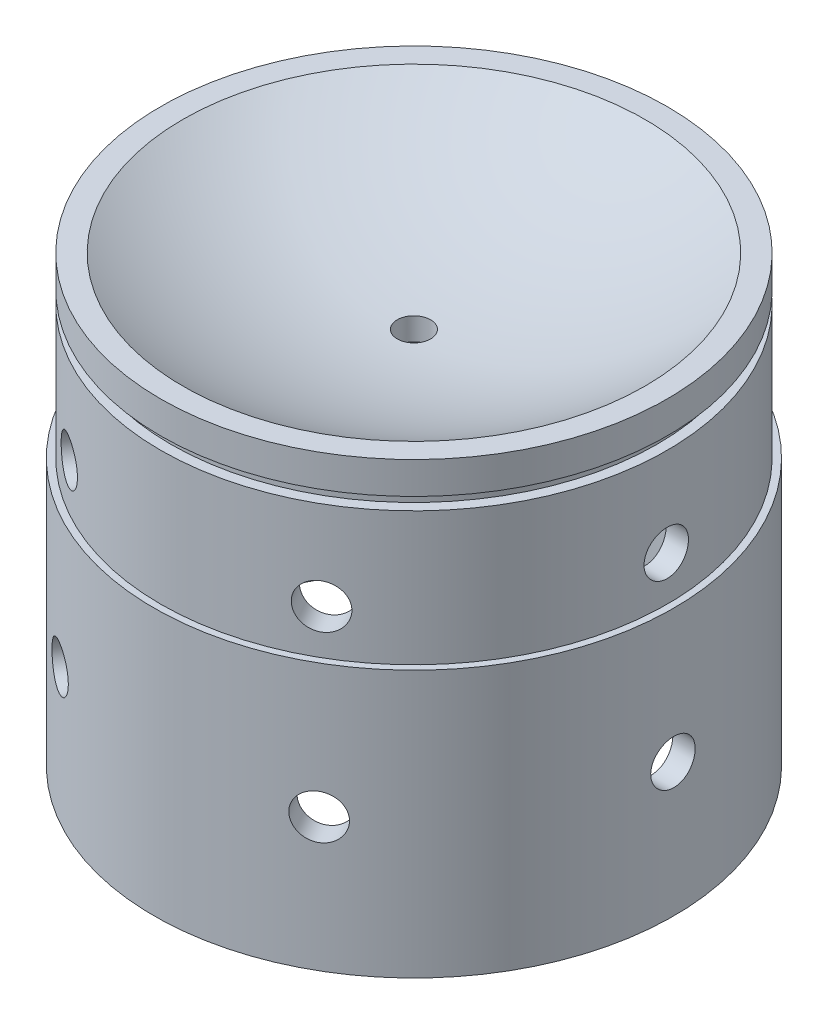
from build123d import *

# Parameters (mm, degrees)
MAIN_LINE_HOLE_REACH      = 148.158
MAIN_LINE_HOLE_END_RADIUS = 123.994333333
SKETCH10_R                = 4.7625
CHAMFER1_SIZE             = 2.54
SCALE1_SCALE              = 0.5
CIRPATTERN1_COUNT         = 6


with BuildPart() as part:
    # Sketch1 → Revolve1 (revolve)
    with BuildSketch(Plane.XY, mode=Mode.PRIVATE) as revolve1_sk:
        with BuildLine():
            Line((0, 6.35), (0, 0))
            Line((0, 0), (66.04, 0))
            Line((66.04, 0), (72.39, 0))
            Line((72.39, 0), (72.39, 12.7))
            Line((72.39, 12.7), (69.469, 12.7))
            Line((69.469, 12.7), (69.469, 16.256))
            Line((69.469, 16.256), (72.39, 16.256))
            Line((72.39, 16.256), (72.39, 25.4))
            Line((72.39, 25.4), (66.04, 25.4))
            ThreePointArc((66.04, 25.4), (34.366350184, 11.207652694), (0, 6.35))
        make_face()
        Polygon((72.39, 0), (66.04, 0), (66.04, -25.4), (67.945, -25.4), (72.39, -25.4), align=None)
        Polygon((74.295, -25.4), (72.39, -25.4), (67.945, -25.4), (67.945, -101.6), (74.295, -101.6), align=None)
    revolve(revolve1_sk.sketch.rotate(Axis((0, 0, 0), (0, 1, 0)), 90), axis=Axis((0, 0, 0), (0, 1, 0)))

    # Main Line Hole: up to this sphere (the profile starts outside it)
    main_line_hole_end = Location((0, 130.344333333, 0)) * Sphere(MAIN_LINE_HOLE_END_RADIUS, mode=Mode.PRIVATE)
    # Sketch10 → Main Line Hole (cut, up to the surface)
    with BuildSketch(Plane.XZ, mode=Mode.PRIVATE) as main_line_hole_sk1:
        with Locations(Location((0, 0, 0), (0, 0, 270))):
            Circle(SKETCH10_R)
    main_line_hole_tool1 = extrude(main_line_hole_sk1.sketch, amount=-MAIN_LINE_HOLE_REACH, mode=Mode.PRIVATE) - main_line_hole_end
    add(main_line_hole_tool1.solids().sort_by_distance((0, 0, 0))[0], mode=Mode.SUBTRACT)

    # Chamfer1
    # the kernel refuses this chamfer: 2.54 mm, written as the material it adds along each edge
    with BuildSketch(Plane(origin=(0, -25.4, 0), x_dir=(0, 0, -1), z_dir=(1, 0, 0))) as chamfer1_piece_1_section:
        Polygon((67.945 - CHAMFER1_SIZE, 0), (67.945, -CHAMFER1_SIZE), (67.945, 0), align=None)
    chamfer1_piece_1 = revolve(axis=Axis((0, -25.4, 0), (0, 1, 0)), mode=Mode.PRIVATE)
    chamfer1_piece_1 = chamfer1_piece_1 - Plane(origin=(0, -26.944579126, 0), x_dir=(0, 0, -1), z_dir=(0, -1, 0)) * Cylinder(66.04, 272, mode=Mode.PRIVATE)
    add(chamfer1_piece_1)


with BuildPart() as part_1:
    # Scale1: scaled about (0, -21.10158913, 0)
    add(part.part.scale(SCALE1_SCALE).moved(Location((0, -10.550794565, 0))))

    # Sketch9 → 1/4 (0.25) Diameter Hole1 (revolve, cut)
    with BuildSketch(Plane(origin=(37.1475, -42.300794565, 0), x_dir=(0, 0, -1), z_dir=(0, 1, 0))):
        Polygon((0, 0), (0, 39.054232465), (3.175, 37.1465), (3.175, 0), align=None)
    f_1_4_0_25_diameter_hole1 = revolve(axis=Axis((43.4975, -42.300794565, 0), (-1, 0, 0)), mode=Mode.SUBTRACT)

    # Sketch8 → 1/4 (0.25) Diameter Hole2 (revolve, cut)
    with BuildSketch(Plane(origin=(36.195, -16.900794565, 0), x_dir=(0, 0, -1), z_dir=(0, 1, 0))):
        Polygon((0, 0), (0, 38.101732465), (3.175, 36.194), (3.175, 0), align=None)
    f_1_4_0_25_diameter_hole2 = revolve(axis=Axis((42.545, -16.900794565, 0), (-1, 0, 0)), mode=Mode.SUBTRACT)

    # CirPattern1: 1/4 (0.25) Diameter Hole1, 1/4 (0.25) Diameter Hole2 ×6 about axis
    cirpattern1_axis = Axis((0, -23.250794565, 0), (0, -1, 0))
    add([f_1_4_0_25_diameter_hole1.rotate(cirpattern1_axis, i * 360 / CIRPATTERN1_COUNT) for i in range(1, CIRPATTERN1_COUNT)], mode=Mode.SUBTRACT)
    add([f_1_4_0_25_diameter_hole2.rotate(cirpattern1_axis, i * 360 / CIRPATTERN1_COUNT) for i in range(1, CIRPATTERN1_COUNT)], mode=Mode.SUBTRACT)


solid = part_1.part
